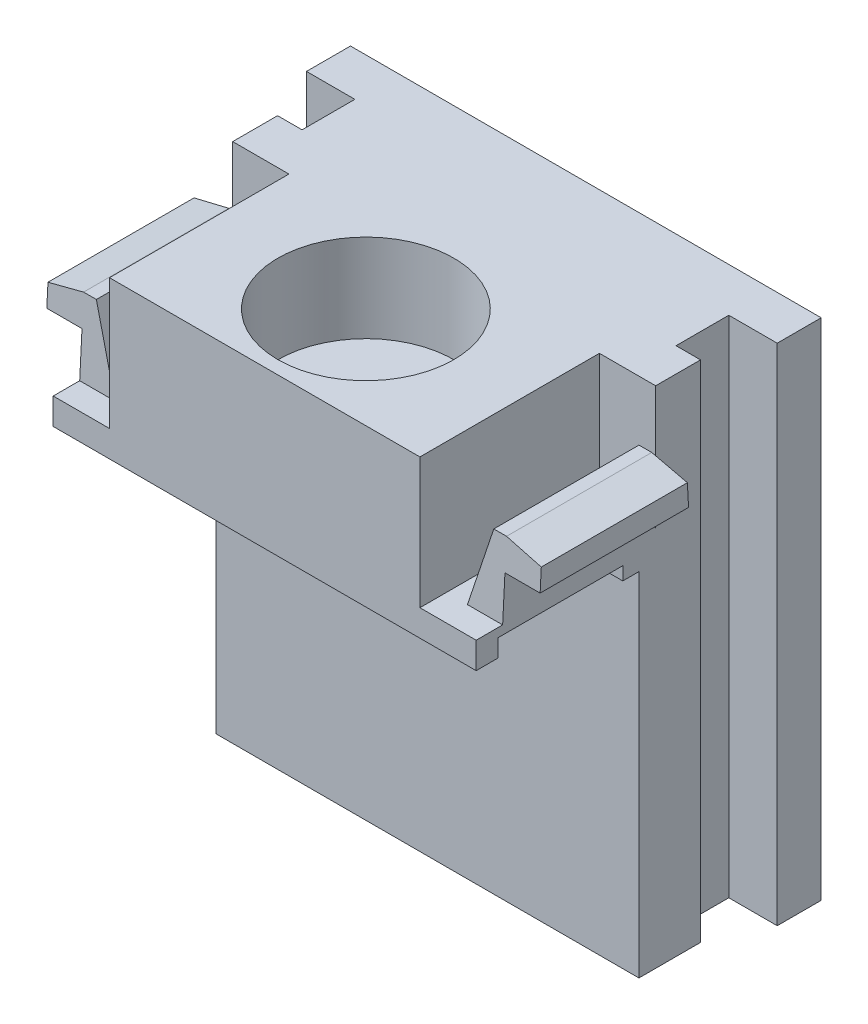
from build123d import *

# Parameters (mm, degrees)
SKETCH2_W                       = 27.178
SKETCH2_H                       = 21.59
INITIAL_EXTRUDE_DEPTH           = 6.35
SKETCH3_W                       = 27.178
SKETCH3_H                       = 1.27
INTIAL_EXTRUDE_HORIZONTAL_DEPTH = 12.192
SKETCH4_W                       = 27.178
SKETCH4_H                       = 1.27
SLIGHT_EXTRUDE_VERTICAL_DEPTH   = 0.254
SKETCH5_W                       = 3.048
SKETCH5_H                       = 21.59
CUT_EXTRUDE1_DEPTH              = 2.794
CUT_EXTRUDE2_REACH              = 33.537
SKETCH6_W                       = 1.379153921
SKETCH6_H                       = 12.954
SNAP_START                      = 11.473246079
SNAP_HOOK2_DEPTH                = 0.7366
SNAP_START_2                    = 8.31223189
SNAP_HOOK2_2_DEPTH              = 8.568362063
SNAP_START_3                    = 8.179116131
SNAP_HOOK2_3_DEPTH              = 8.834593581
SNAP_START_4                    = 9
SNAP_HOOK2_4_DEPTH              = 6
BOSS_EXTRUDE1_DEPTH             = 7.54
SKETCH8_W                       = 24.419692158
SKETCH8_H                       = 7.195933706
CUT_EXTRUDE3_DEPTH              = 0.762
SKETCH9_W                       = 24.419692158
SKETCH9_H                       = 20.32
BOSS_EXTRUDE2_DEPTH             = 2.794
SKETCH10_R                      = 5.08
CUT_EXTRUDE4_DEPTH              = 5.08


with BuildPart() as part:
    # Sketch2 → Initial Extrude (new body)
    with BuildSketch(Plane.XY):
        Rectangle(SKETCH2_W, SKETCH2_H)
    extrude(amount=INITIAL_EXTRUDE_DEPTH)

    # Sketch3 → Intial Extrude horizontal (add)
    with BuildSketch(Plane.XY.offset(6.35)):
        with Locations((0, 10.16)):
            Rectangle(SKETCH3_W, SKETCH3_H)
    extrude(amount=INTIAL_EXTRUDE_HORIZONTAL_DEPTH)

    # Sketch4 → Slight Extrude vertical (add)
    with BuildSketch(Plane.XZ.offset(-9.525)):
        with Locations((0, 17.907)):
            Rectangle(SKETCH4_W, SKETCH4_H)
    extrude(amount=SLIGHT_EXTRUDE_VERTICAL_DEPTH)

    # Sketch5 → Cut-Extrude1 (cut)
    with BuildSketch(Plane.ZY.offset(13.589)):
        with Locations((4.064, 0)):
            Rectangle(SKETCH5_W, SKETCH5_H)
    cut_extrude1 = extrude(amount=-CUT_EXTRUDE1_DEPTH, mode=Mode.SUBTRACT)

    # Mirror3: Cut-Extrude1 across plane
    add(cut_extrude1.mirror(Plane(origin=(0, 0, 0), x_dir=(0, 0, 1), z_dir=(1, 0, 0))), mode=Mode.SUBTRACT)

    # Sketch6 → Cut-Extrude2 (cut, up to next)
    with BuildSketch(Plane(origin=(0, 10.795, 0), x_dir=(1, 0, 0), z_dir=(0, 1, 0)), mode=Mode.PRIVATE) as cut_extrude2_sk1:
        with Locations((12.89942304, -12.065)):
            Rectangle(SKETCH6_W, SKETCH6_H)
    cut_extrude2_tool1 = extrude(cut_extrude2_sk1.sketch, amount=-CUT_EXTRUDE2_REACH, mode=Mode.PRIVATE) & part.part
    cut_extrude2 = cut_extrude2_tool1.solids().sort_by_distance((12.899423, 10.795, 12.065))[0]
    add(cut_extrude2, mode=Mode.SUBTRACT)

    # Mirror7: Cut-Extrude2 across plane
    add(cut_extrude2.mirror(Plane(origin=(0, 0, 0), x_dir=(0, 0, 1), z_dir=(1, 0, 0))), mode=Mode.SUBTRACT)

    # Snap Hook2: read off the stored shape, not the designer's step
    # Snap Hook2 outline → Snap Hook2 (add)
    with BuildSketch(Plane.YZ.offset(SNAP_START)):
        Polygon((10.795, 17.013709712), (10.795, 8.179116131), (15.113, 8.405412922), (15.113, 16.787412922), align=None)
    snap_hook2 = extrude(amount=SNAP_HOOK2_DEPTH)

    # Snap Hook2 2 outline → Snap Hook2 2 (add)
    with BuildSketch(Plane.XY.offset(SNAP_START_2)):
        Polygon((11.473246079, 10.795), (11.473246079, 15.113), (10.177846079, 10.795), align=None)
        Polygon((12.209846079, 15.113), (12.209846079, 13.335), (14.241846079, 13.335), (14.241846079, 14.605), align=None)
    snap_hook2_2 = extrude(amount=SNAP_HOOK2_2_DEPTH)

    # Snap Hook2 3 outline → Snap Hook2 3 (add)
    with BuildSketch(Plane.XY.offset(SNAP_START_3)):
        Polygon((11.473246079, 10.795), (11.473246079, 15.113), (10.177846079, 10.795), align=None)
    snap_hook2_3 = extrude(amount=SNAP_HOOK2_3_DEPTH)

    # Snap Hook2 4 outline → Snap Hook2 4 (cut)
    with BuildSketch(Plane.YZ.offset(SNAP_START_4)):
        Polygon((10.795, 8.179116131), (17, 8.179116131), (17, 8.504306402), (15.113, 8.405412922), align=None)
        Polygon((15.113, 16.787412922), (17, 16.688519443), (17, 17.013709712), (10.795, 17.013709712), align=None)
    snap_hook2_4 = extrude(amount=SNAP_HOOK2_4_DEPTH, mode=Mode.SUBTRACT)

    # Mirror6: Snap Hook2, Snap Hook2 2, Snap Hook2 3, Snap Hook2 4 across plane
    add(snap_hook2.mirror(Plane(origin=(0, 0, 0), x_dir=(0, 0, 1), z_dir=(1, 0, 0))))
    add(snap_hook2_2.mirror(Plane(origin=(0, 0, 0), x_dir=(0, 0, 1), z_dir=(1, 0, 0))))
    add(snap_hook2_3.mirror(Plane(origin=(0, 0, 0), x_dir=(0, 0, 1), z_dir=(1, 0, 0))))
    add(snap_hook2_4.mirror(Plane(origin=(0, 0, 0), x_dir=(0, 0, 1), z_dir=(1, 0, 0))), mode=Mode.SUBTRACT)

    # Sketch7 → Boss-Extrude1 (add)
    with BuildSketch(Plane(origin=(0, 10.795, 0), x_dir=(1, 0, 0), z_dir=(0, 1, 0))):
        Polygon((-8.962447439, -8.179116131), (-8.962447439, -18.542), (8.962447439, -18.542), (8.962447439, -8.179116131), (9, -8.179116131), (10.177846079, -8.179116131), (12.209846079, -8.179116131), (12.209846079, -5.588), (10.795, -5.588), (10.795, -2.54), (13.589, -2.54), (13.589, 0), (-13.589, 0), (-13.589, -2.54), (-10.795, -2.54), (-10.795, -5.588), (-12.209846079, -5.588), (-12.209846079, -8.179116131), (-10.177846079, -8.179116131), (-9, -8.179116131), align=None)
    extrude(amount=BOSS_EXTRUDE1_DEPTH)

    # Sketch8 → Cut-Extrude3 (cut)
    with BuildSketch(Plane.XZ.offset(-9.525)):
        with Locations((0, 13.674033147)):
            Rectangle(SKETCH8_W, SKETCH8_H)
    extrude(amount=-CUT_EXTRUDE3_DEPTH, mode=Mode.SUBTRACT)

    # Sketch9 → Boss-Extrude2 (add)
    with BuildSketch(Plane.XY.offset(6.35)):
        with Locations((0, -0.635)):
            Rectangle(SKETCH9_W, SKETCH9_H)
    extrude(amount=BOSS_EXTRUDE2_DEPTH)

    # Sketch10 → Cut-Extrude4 (cut)
    with BuildSketch(Plane(origin=(0, 18.335, 0), x_dir=(1, 0, 0), z_dir=(0, 1, 0))):
        with Locations(Location((0, -12.7, 0), (0, 0, 270))):
            Circle(SKETCH10_R)
    extrude(amount=-CUT_EXTRUDE4_DEPTH, mode=Mode.SUBTRACT)


solid = part.part
